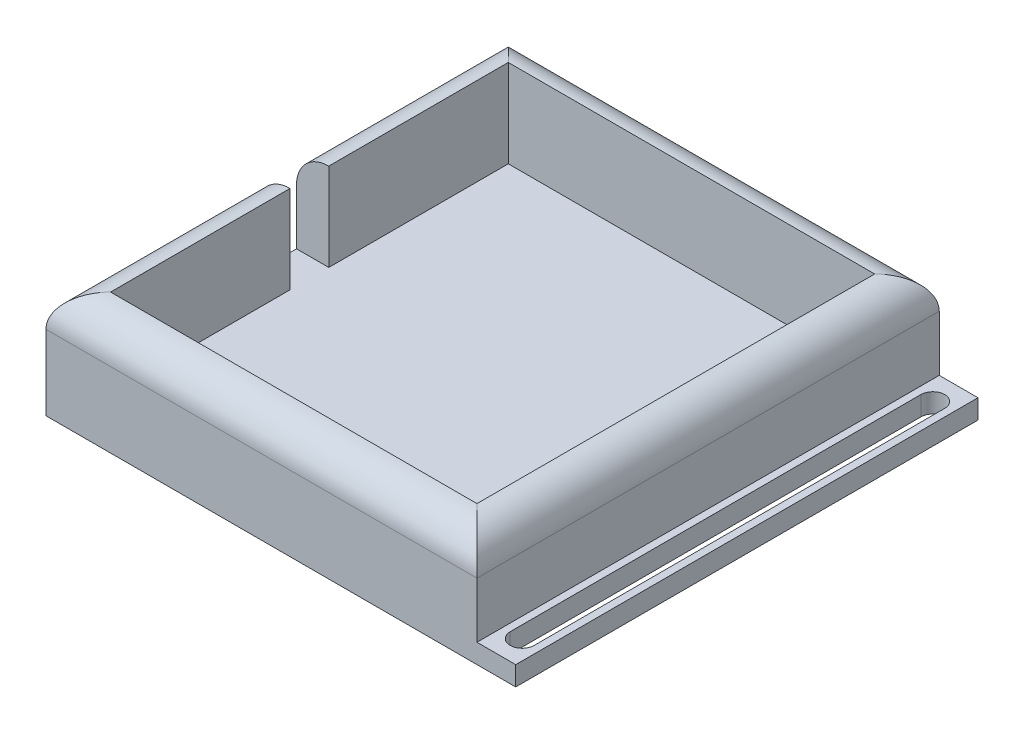
from build123d import *

# Parameters (mm, degrees)
BOSS_EXTRUDE1_DEPTH = 13.6
BOSS_EXTRUDE2_DEPTH = 3
FILLET1_START       = -66.6
FILLET1_DEPTH       = 71.6
FILLET1_START_2     = -6
FILLET1_2_DEPTH     = 69
SKETCH3_W           = 6
SKETCH3_H           = 71.6
BOSS_EXTRUDE4_DEPTH = 3


with BuildPart() as part:
    # Sketch1 → Boss-Extrude1 (new body)
    with BuildSketch(Plane(origin=(0, 0, 0), x_dir=(1, 0, 0), z_dir=(0, 1, 0))):
        Polygon((56.75, 30.8), (61.75, 30.8), (61.75, 66.6), (-5, 66.6), (-5, 33.8), (0, 33.8), (0, 61.6), (56.75, 61.6), align=None)
        Polygon((-5, 27.8), (-5, -5), (61.75, -5), (61.75, 30.8), (56.75, 30.8), (56.75, 0), (0, 0), (0, 27.8), align=None)
    extrude(amount=BOSS_EXTRUDE1_DEPTH)

    # Sketch2 → Boss-Extrude2 (add)
    with BuildSketch(Plane.XZ):
        Polygon((0, 0), (56.75, 0), (56.75, -61.6), (0, -61.6), (0, -33.8), (-5, -33.8), (-5, -66.6), (61.75, -66.6), (61.75, 5), (-5, 5), (-5, -27.8), (0, -27.8), align=None)
        Polygon((-5, -27.8), (-5, -33.8), (0, -33.8), (0, -61.6), (56.75, -61.6), (56.75, 0), (0, 0), (0, -27.8), align=None)
    extrude(amount=BOSS_EXTRUDE2_DEPTH)

    # Fillet1: read off the stored shape, not the designer's step
    # Fillet1 outline → Fillet1 (cut)
    with BuildSketch(Plane.XY.offset(FILLET1_START)):
        with BuildLine():
            Line((-5, 13.6), (-5, 8.6))
            ThreePointArc((-5, 8.6), (-3.535533906, 12.135533906), (0, 13.6))
            Line((0, 13.6), (-5, 13.6))
        make_face()
        with BuildLine():
            Line((61.75, 13.6), (56.75, 13.6))
            ThreePointArc((56.75, 13.6), (60.285533906, 12.135533906), (61.75, 8.6))
            Line((61.75, 8.6), (61.75, 13.6))
        make_face()
    extrude(amount=FILLET1_DEPTH, mode=Mode.SUBTRACT)

    # Fillet1 2 outline → Fillet1 2 (cut)
    with BuildSketch(Plane.YZ.offset(FILLET1_START_2)):
        with BuildLine():
            Line((13.6, 5), (8.6, 5))
            ThreePointArc((8.6, 5), (12.135533906, 3.535533906), (13.6, 0))
            Line((13.6, 0), (13.6, 5))
        make_face()
        with BuildLine():
            ThreePointArc((13.6, -61.6), (12.135533906, -65.135533906), (8.6, -66.6))
            Line((8.6, -66.6), (13.6, -66.6))
            Line((13.6, -66.6), (13.6, -61.6))
        make_face()
    extrude(amount=FILLET1_2_DEPTH, mode=Mode.SUBTRACT)

    # Sketch3 → Boss-Extrude4 (add)
    with BuildSketch(Plane.XZ.offset(3)):
        with Locations((64.75, -30.8)):
            Rectangle(SKETCH3_W, SKETCH3_H)
        with BuildLine():
            ThreePointArc((62.9, -62.6), (64.75, -64.45), (66.6, -62.6))
            Line((66.6, -62.6), (66.6, 1))
            ThreePointArc((66.6, 1), (64.75, 2.85), (62.9, 1))
            Line((62.9, 1), (62.9, -62.6))
        make_face(mode=Mode.SUBTRACT)
    extrude(amount=-BOSS_EXTRUDE4_DEPTH)


solid = part.part
